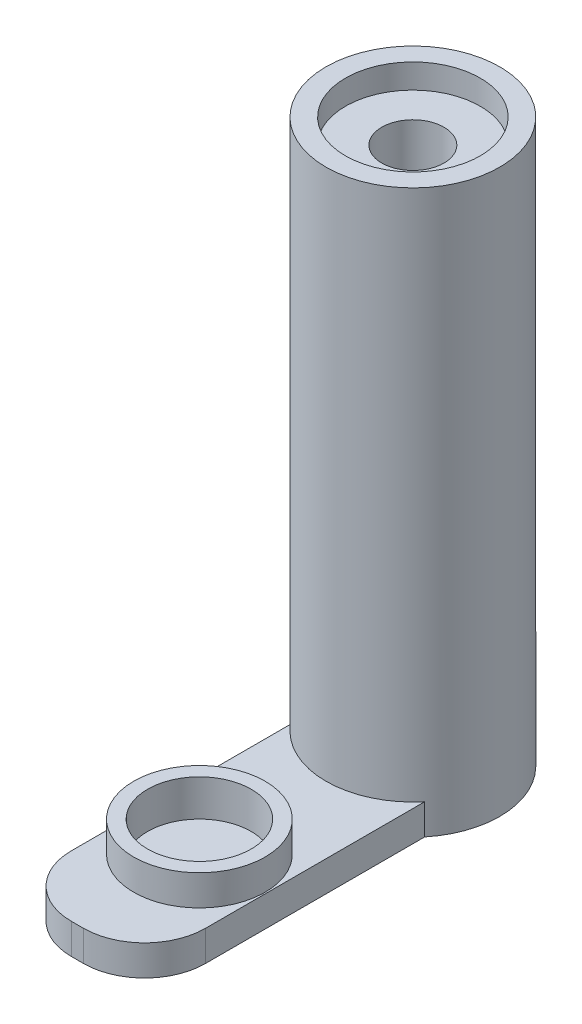
from build123d import *

# Parameters (mm, degrees)
SKETCH1_R           = 14.25
BOSS_EXTRUDE1_DEPTH = 92.2
SKETCH2_R           = 5.1
CUT_EXTRUDE1_DEPTH  = 92.2
SKETCH3_R           = 11.05
CUT_EXTRUDE2_DEPTH  = 4
BOSS_EXTRUDE2_DEPTH = 5
SKETCH6_R           = 8.5
CUT_EXTRUDE3_DEPTH  = 1
FILLET1_R           = 10
BOSS_EXTRUDE3_START = 5
SKETCH7_R           = 10.773488024
SKETCH7_R_2         = 8.5
BOSS_EXTRUDE3_DEPTH = 5


with BuildPart() as part:
    # Sketch1 → Boss-Extrude1 (new body)
    with BuildSketch(Plane(origin=(0, 0, 0), x_dir=(1, 0, 0), z_dir=(0, 1, 0))):
        Circle(SKETCH1_R)
    extrude(amount=BOSS_EXTRUDE1_DEPTH)

    # Sketch2 → Cut-Extrude1 (cut)
    with BuildSketch(Plane(origin=(0, 92.2, 0), x_dir=(1, 0, 0), z_dir=(0, 1, 0))):
        Circle(SKETCH2_R)
    extrude(amount=-CUT_EXTRUDE1_DEPTH, mode=Mode.SUBTRACT)

    # Sketch3 → Cut-Extrude2 (cut)
    with BuildSketch(Plane(origin=(0, 92.2, 0), x_dir=(1, 0, 0), z_dir=(0, 1, 0))):
        Circle(SKETCH3_R)
    extrude(amount=-CUT_EXTRUDE2_DEPTH, mode=Mode.SUBTRACT)

    # Sketch4 → Boss-Extrude2 (add)
    with BuildSketch(Plane.XZ):
        with BuildLine():
            Line((-11, 55), (11, 55))
            Line((11, 55), (11, 9.058835466))
            ThreePointArc((11, 9.058835466), (0, -14.25), (-11, 9.058835466))
            Line((-11, 9.058835466), (-11, 55))
        make_face()
    extrude(amount=-BOSS_EXTRUDE2_DEPTH)

    # Sketch6 → Cut-Extrude3 (cut)
    with BuildSketch(Plane(origin=(0, 5, 0), x_dir=(1, 0, 0), z_dir=(0, 1, 0))):
        with Locations((0, -35)):
            Circle(SKETCH6_R)
    extrude(amount=-CUT_EXTRUDE3_DEPTH, mode=Mode.SUBTRACT)

    # Fillet1
    fillet1_edges = [part.edges().sort_by_distance(p)[0] for p in [
        (-11, 2.5, 55),
        (11, 2.5, 55),
    ]]
    fillet(fillet1_edges, radius=FILLET1_R)

    # Sketch7 → Boss-Extrude3 (add)
    with BuildSketch(Plane(origin=(0, 5, 0), x_dir=(1, 0, 0), z_dir=(0, 1, 0)).offset(BOSS_EXTRUDE3_START)):
        with Locations((0, -35)):
            Circle(SKETCH7_R)
        with Locations((0, -35)):
            Circle(SKETCH7_R_2, mode=Mode.SUBTRACT)
    extrude(amount=-BOSS_EXTRUDE3_DEPTH)


solid = part.part
